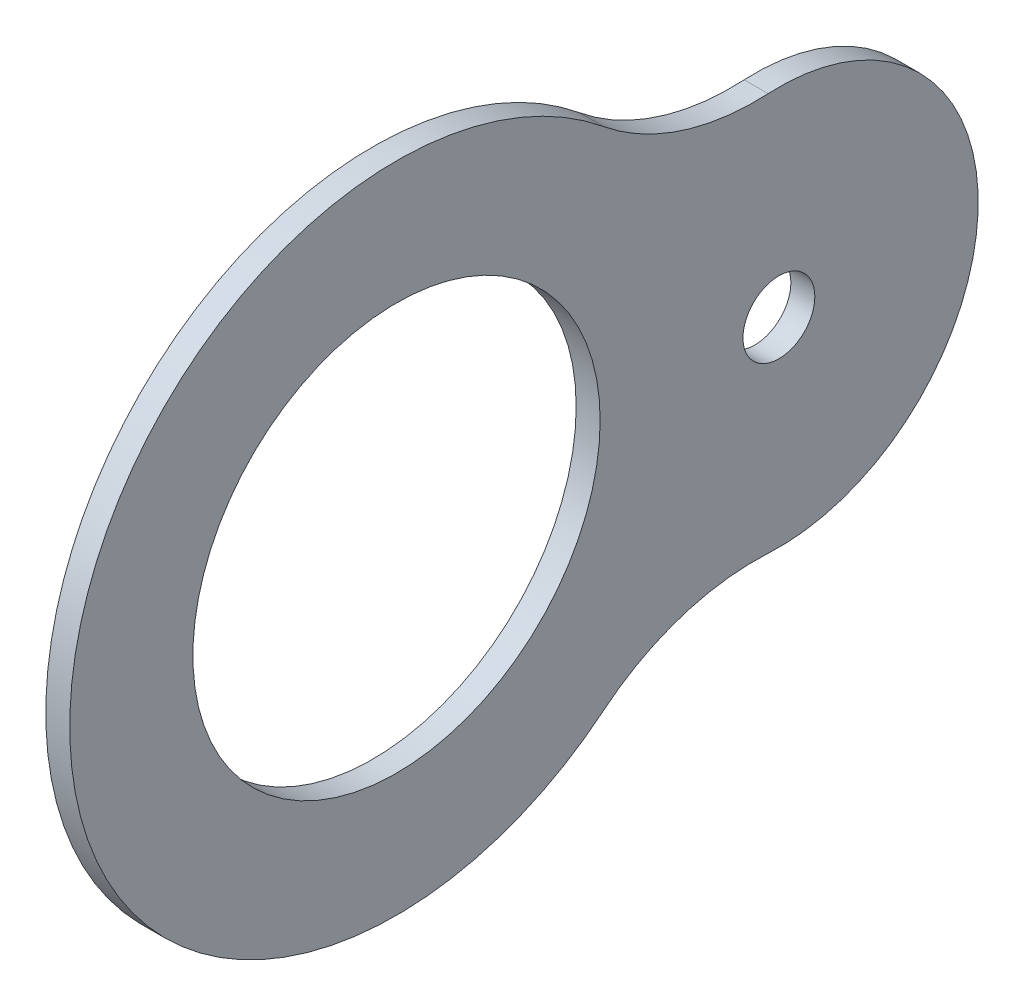
from build123d import *

# Parameters (mm, degrees)
SKETCH_1_R      = 8.5
SKETCH_1_R_2    = 1.5
EXTRUDE_1_DEPTH = 1
FILLET_1_R      = 10


with BuildPart() as part:
    # Эскиз1 → Бобышка-Вытянуть1 (new body)
    with BuildSketch(Plane(origin=(0, 0, 0), x_dir=(0, 0, -1), z_dir=(1, 0, 0))):
        with BuildLine():
            ThreePointArc((11.64, -7.110555534), (24.28, 0), (11.64, 7.110555534))
            ThreePointArc((11.64, 7.110555534), (-13.64, 0), (11.64, -7.110555534))
        make_face()
        Circle(SKETCH_1_R, mode=Mode.SUBTRACT)
        with Locations((15.96, 0)):
            Circle(SKETCH_1_R_2, mode=Mode.SUBTRACT)
    extrude(amount=EXTRUDE_1_DEPTH)

    # Скругление1
    fillet_1_edges = [part.edges().sort_by_distance(p)[0] for p in [
        (0.5, -7.110555534, -11.64),
        (0.5, 7.110555534, -11.64),
    ]]
    fillet(fillet_1_edges, radius=FILLET_1_R)


solid = part.part
